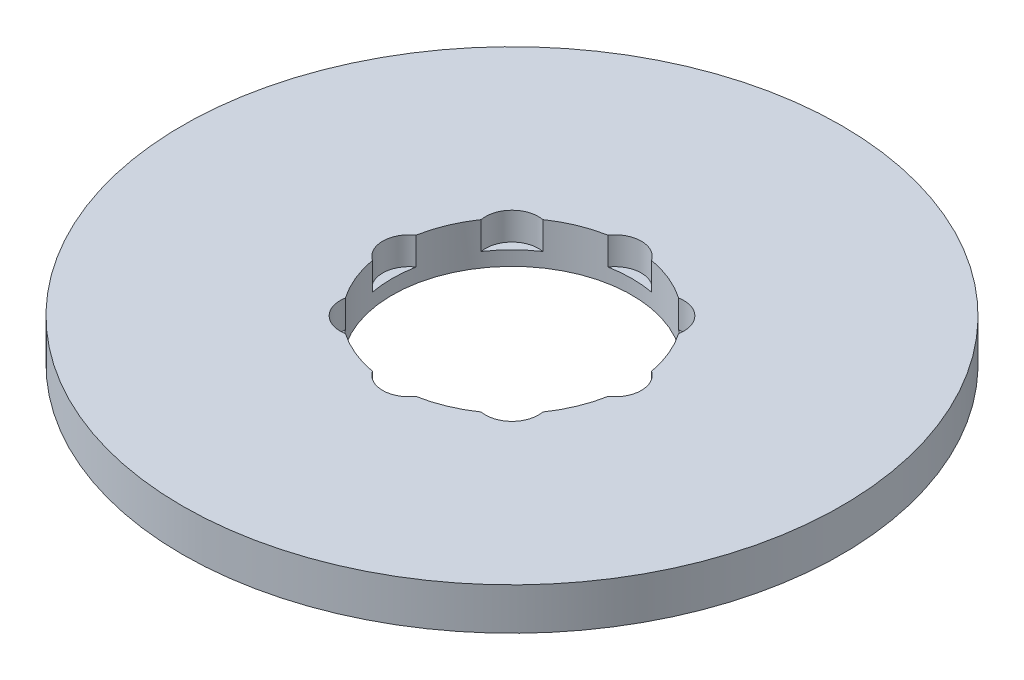
from build123d import *

# Parameters (mm, degrees)
SKETCH1_R           = 55
BOSS_EXTRUDE1_DEPTH = 7
SKETCH2_R           = 20
CUT_EXTRUDE1_DEPTH  = 79.096094653
SKETCH3_R           = 4.407050114
CUT_EXTRUDE2_DEPTH  = 4.606761966
CIRPATTERN1_COUNT   = 8


with BuildPart() as part:
    # Sketch1 → Boss-Extrude1 (new body)
    with BuildSketch(Plane(origin=(0, 0, 0), x_dir=(1, 0, 0), z_dir=(0, 1, 0))):
        Circle(SKETCH1_R)
    extrude(amount=BOSS_EXTRUDE1_DEPTH)

    # Sketch2 → Cut-Extrude1 (cut, through all)
    with BuildSketch(Plane(origin=(0, 0, 0), x_dir=(1, 0, 0), z_dir=(0, 1, 0))):
        Circle(SKETCH2_R)
    extrude(amount=CUT_EXTRUDE1_DEPTH, mode=Mode.SUBTRACT)

    # Sketch3 → Cut-Extrude2 (cut)
    with BuildSketch(Plane(origin=(0, 7, 0), x_dir=(1, 0, 0), z_dir=(0, 1, 0))):
        with Locations((-17.175329497, 0)):
            Circle(SKETCH3_R)
    cut_extrude2 = extrude(amount=-CUT_EXTRUDE2_DEPTH, mode=Mode.SUBTRACT)

    # CirPattern1: Cut-Extrude2 ×8 about axis
    cirpattern1_axis = Axis((0, 0, 0), (0, 1, 0))
    for i in range(1, CIRPATTERN1_COUNT):
        add(cut_extrude2.rotate(cirpattern1_axis, i * 360 / CIRPATTERN1_COUNT), mode=Mode.SUBTRACT)


solid = part.part
